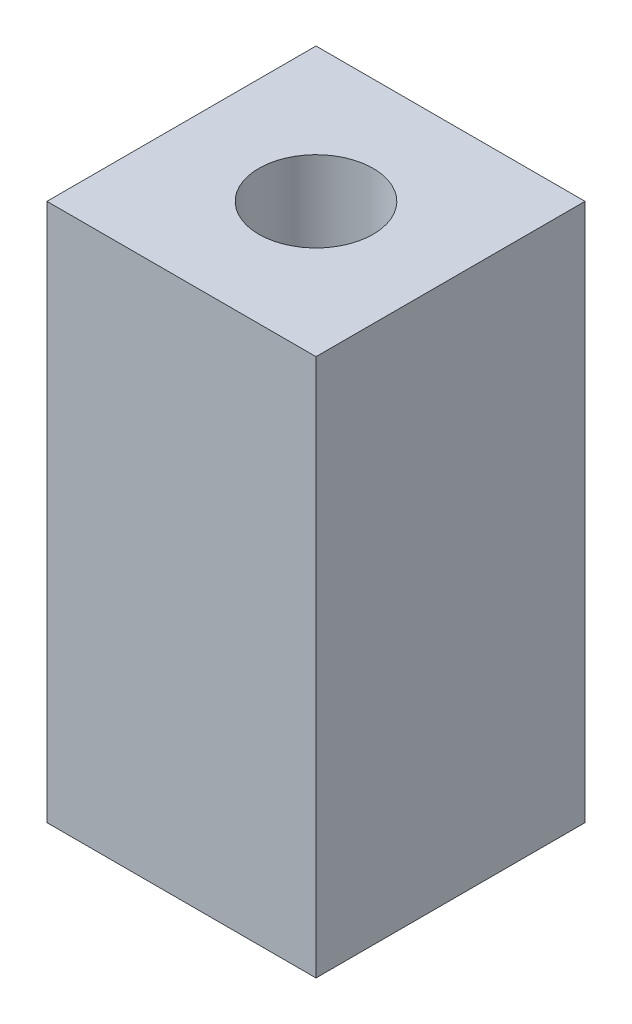
from build123d import *

# Parameters (mm, degrees)
SKETCH1_W           = 15.875
SKETCH1_H           = 15.875
SKETCH1_R           = 3.3734375
BOSS_EXTRUDE1_DEPTH = 31.75


with BuildPart() as part:
    # Sketch1 → Boss-Extrude1 (new body)
    with BuildSketch(Plane(origin=(0, 0, 0), x_dir=(1, 0, 0), z_dir=(0, 1, 0))):
        Rectangle(SKETCH1_W, SKETCH1_H)
        Circle(SKETCH1_R, mode=Mode.SUBTRACT)
    extrude(amount=BOSS_EXTRUDE1_DEPTH)


solid = part.part
